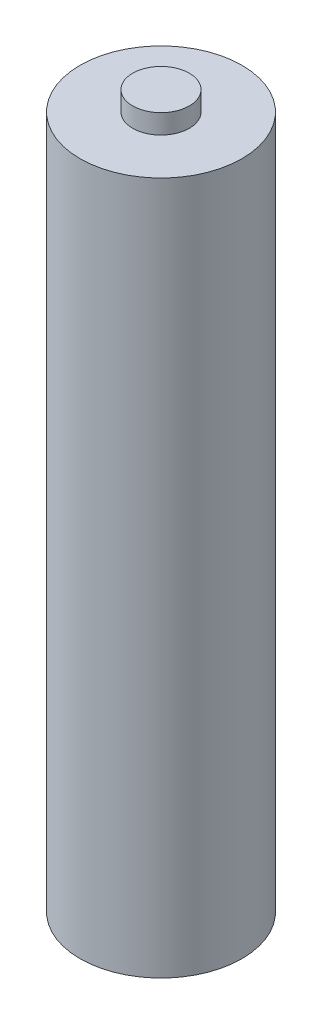
from build123d import *

# Parameters (mm, degrees)
SKETCH_1_W = 1.75
SKETCH_1_H = 1.2


with BuildPart() as part:
    # 草图1 → 旋转1 (revolve)
    with BuildSketch(Plane(origin=(0, 0, 0), x_dir=(0, 0, -1), z_dir=(1, 0, 0))):
        with Locations((0.875, 0.6)):
            Rectangle(SKETCH_1_W, SKETCH_1_H)
        Polygon((1.75, 0), (0, 0), (0, -42.8), (5, -42.8), (5, 0), align=None)
    revolve(axis=Axis((0, 0, 0), (0, -1, 0)))


solid = part.part
